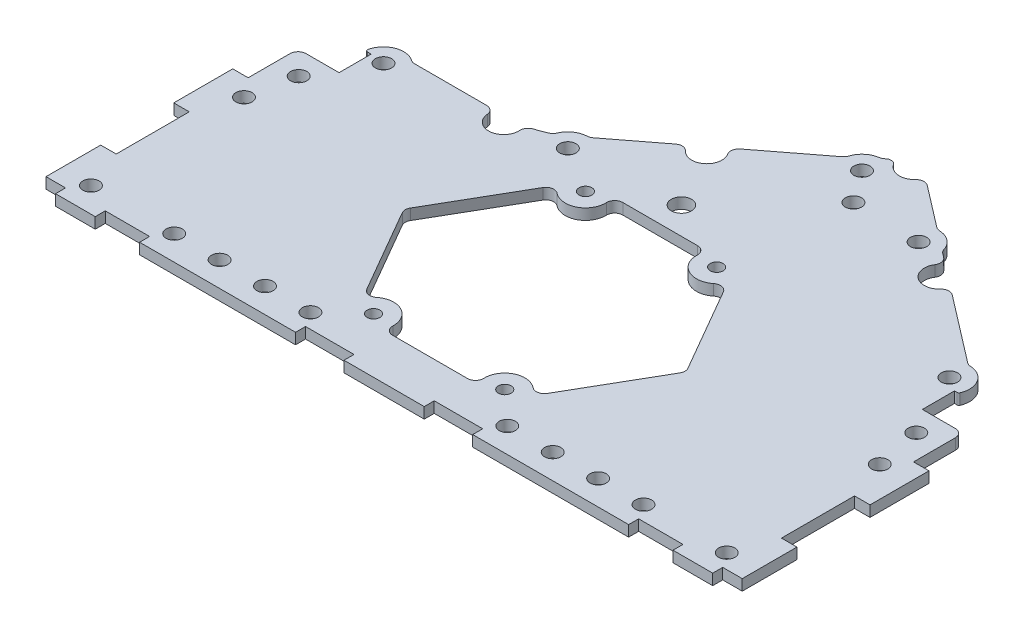
from build123d import *

# Parameters (mm, degrees)
SKETCH44_R              = 2.5527
TOP_PLATE_EXTRUDE_DEPTH = 3.429
SKETCH82_R              = 4.7625
CUT_EXTRUDE38_DEPTH     = 3.429
SKETCH72_W              = 4.7498
SKETCH72_H              = 17.4625
SKETCH72_W_2            = 49.2125
SKETCH72_H_2            = 3.0226
SKETCH72_H_3            = 18.806813894
SKETCH72_W_3            = 12.7
SKETCH72_H_4            = 9.525
BOSS_EXTRUDE27_DEPTH    = 3.429
SKETCH86_R              = 6.35
SKETCH86_R_2            = 2.5527
BOSS_EXTRUDE31_DEPTH    = 3.429
SKETCH111_W             = 17.7673
SKETCH111_H             = 10.0965
CUT_EXTRUDE57_DEPTH     = 191.27116943
SKETCH92_W              = 4.859785226
SKETCH92_H              = 15.6845
SKETCH92_W_2            = 4.8768
SKETCH92_H_2            = 22.987
SKETCH92_W_3            = 6.1468
SKETCH92_H_3            = 3.1496
SKETCH92_W_4            = 13.95095
SKETCH92_W_5            = 15.24635
CUT_EXTRUDE44_DEPTH     = 191.27116943
SKETCH95_R              = 2.0193
CUT_EXTRUDE47_DEPTH     = 25.4
SKETCH99_R              = 3.175
CUT_EXTRUDE50_DEPTH     = 191.27116943
FILLET5_R               = 2.54
FILLET6_R               = 2.54
FILLET7_R               = 2.54
FILLET8_R               = 1.905
FILLET42_R              = 0.635


with BuildPart() as part:
    # Sketch44 → Top Plate Extrude----------- (new body)
    with BuildSketch(Plane(origin=(0, 25.4, 0), x_dir=(1, 0, 0), z_dir=(0, 1, 0))):
        with BuildLine():
            Line((-104.775, -68.124686106), (-104.775, -152.527))
            Line((-104.775, -152.527), (104.775, -152.527))
            Line((104.775, -152.527), (104.775, -68.124686106))
            Line((104.775, -68.124686106), (92.075, -68.124686106))
            Line((92.075, -68.124686106), (92.075, -62.647632589))
            Line((92.075, -62.647632589), (21.81178084, -8.732768266))
            ThreePointArc((21.81178084, -8.732768266), (18.724426226, -14.191930366), (14.302849775, -18.63983673))
            Line((14.302849775, -18.63983673), (-38.049902469, -58.811516421))
            ThreePointArc((-38.049902469, -58.811516421), (-44.800532006, -62.419803084), (-52.352752243, -63.666679691))
            Line((-52.352752243, -63.666679691), (-92.075, -63.666679691))
            Line((-92.075, -63.666679691), (-92.075, -68.124686106))
            Line((-92.075, -68.124686106), (-104.775, -68.124686106))
        make_face()
        with Locations(Location((-73.83145, -147.7645, 0), (0, 0, 90))):
            Circle(SKETCH44_R, mode=Mode.SUBTRACT)
        with Locations(Location((-59.54395, -147.7645, 0), (0, 0, 90))):
            Circle(SKETCH44_R, mode=Mode.SUBTRACT)
        with Locations(Location((-45.25645, -147.7645, 0), (0, 0, 90))):
            Circle(SKETCH44_R, mode=Mode.SUBTRACT)
        with Locations(Location((-30.96895, -147.7645, 0), (0, 0, 90))):
            Circle(SKETCH44_R, mode=Mode.SUBTRACT)
        with Locations(Location((-100.0125, -99.6315, 0), (0, 0, 270))):
            Circle(SKETCH44_R, mode=Mode.SUBTRACT)
        with Locations(Location((-100.0125, -147.7645, 0), (0, 0, 270))):
            Circle(SKETCH44_R, mode=Mode.SUBTRACT)
        with Locations(Location((100.0125, -147.7645, 0), (0, 0, 90))):
            Circle(SKETCH44_R, mode=Mode.SUBTRACT)
        with Locations(Location((100.0125, -99.6315, 0), (0, 0, 90))):
            Circle(SKETCH44_R, mode=Mode.SUBTRACT)
        with Locations(Location((30.96895, -147.7645, 0), (0, 0, 270))):
            Circle(SKETCH44_R, mode=Mode.SUBTRACT)
        with Locations(Location((45.25645, -147.7645, 0), (0, 0, 270))):
            Circle(SKETCH44_R, mode=Mode.SUBTRACT)
        with Locations(Location((59.54395, -147.7645, 0), (0, 0, 270))):
            Circle(SKETCH44_R, mode=Mode.SUBTRACT)
        with Locations(Location((73.83145, -147.7645, 0), (0, 0, 270))):
            Circle(SKETCH44_R, mode=Mode.SUBTRACT)
        with Locations(Location((-87.3125, -68.429179691, 0), (0, 0, 270))):
            Circle(SKETCH44_R, mode=Mode.SUBTRACT)
        with Locations(Location((-35.150676163, -62.589861704, 0), (0, 0, 270))):
            Circle(SKETCH44_R, mode=Mode.SUBTRACT)
        with Locations(Location((17.20207608, -22.418182013, 0), (0, 0, 270))):
            Circle(SKETCH44_R, mode=Mode.SUBTRACT)
        with Locations(Location((45.531325629, -32.936414996, 0), (0, 0, 270))):
            Circle(SKETCH44_R, mode=Mode.SUBTRACT)
        with Locations(Location((87.3125, -64.996237681, 0), (0, 0, 270))):
            Circle(SKETCH44_R, mode=Mode.SUBTRACT)
        with Locations(Location((-97.155, -85.269686106, 0), (0, 0, 270))):
            Circle(SKETCH44_R, mode=Mode.SUBTRACT)
        with Locations(Location((24.512056641, -32.4155623, 0), (0, 0, 270))):
            Circle(SKETCH44_R, mode=Mode.SUBTRACT)
        with Locations(Location((97.155, -85.269686106, 0), (0, 0, 270))):
            Circle(SKETCH44_R, mode=Mode.SUBTRACT)
    extrude(amount=TOP_PLATE_EXTRUDE_DEPTH)

    # Sketch82 → Cut-Extrude38 (cut)
    with BuildSketch(Plane(origin=(0, 28.829, 0), x_dir=(1, 0, 0), z_dir=(0, 1, 0))):
        with Locations((-52.352752243, -65.571679691)):
            Circle(SKETCH82_R)
        with Locations((-12.44667807, -41.56667131)):
            Circle(SKETCH82_R)
        with Locations((58.296246284, -39.129483192)):
            Circle(SKETCH82_R)
        with BuildLine():
            Line((21.464274093, -9.555101394), (21.81178084, -8.732768266))
            Line((21.81178084, -8.732768266), (22.214272521, -9.041610995))
            ThreePointArc((22.214272521, -9.041610995), (27.20799018, -17.139845005), (21.464274093, -9.555101394))
        make_face()
    extrude(amount=-CUT_EXTRUDE38_DEPTH, mode=Mode.SUBTRACT)

    # Sketch72 → Boss-Extrude27 (add, through all)
    with BuildSketch(Plane(origin=(0, 25.4, 0), x_dir=(1, 0, 0), z_dir=(0, 1, 0))):
        with Locations((-107.1499, -143.79575)):
            Rectangle(SKETCH72_W, SKETCH72_H)
        with Locations((-52.4002, -154.0383)):
            Rectangle(SKETCH72_W_2, SKETCH72_H_2)
        with Locations((-107.1499, -102.928093053)):
            Rectangle(SKETCH72_W, SKETCH72_H_3)
        with Locations((-6.35, -154.0383)):
            Rectangle(SKETCH72_W_3, SKETCH72_H_2)
        with Locations((-107.1499, -72.887186106)):
            Rectangle(SKETCH72_W, SKETCH72_H_4)
        with Locations((-97.155, -154.0383)):
            Rectangle(SKETCH72_W_3, SKETCH72_H_2)
    boss_extrude27 = extrude(amount=BOSS_EXTRUDE27_DEPTH)

    # Mirror22: Boss-Extrude27 across plane
    add(boss_extrude27.mirror(Plane(origin=(0, 0, 0), x_dir=(0, 0, 1), z_dir=(1, 0, 0))))

    # Sketch86 → Boss-Extrude31 (add, through all)
    # profile 1 of 5: a face of its own
    with BuildSketch(Plane(origin=(0, 28.829, 0), x_dir=(1, 0, 0), z_dir=(0, 1, 0))):
        with Locations((87.3125, -64.996237681)):
            Circle(SKETCH86_R)
        with Locations(Location((87.3125, -64.996237681, 0), (0, 0, 270))):
            Circle(SKETCH86_R_2, mode=Mode.SUBTRACT)
    # profile 2 of 5: a face of its own
    with BuildSketch(Plane(origin=(0, 28.829, 0), x_dir=(1, 0, 0), z_dir=(0, 1, 0))):
        with Locations((17.20207608, -22.418182013)):
            Circle(SKETCH86_R)
        with Locations(Location((17.20207608, -22.418182013, 0), (0, 0, 270))):
            Circle(SKETCH86_R_2, mode=Mode.SUBTRACT)
    # profile 3 of 5: a face of its own
    with BuildSketch(Plane(origin=(0, 28.829, 0), x_dir=(1, 0, 0), z_dir=(0, 1, 0))):
        with Locations((45.531325629, -32.936414996)):
            Circle(SKETCH86_R)
        with Locations(Location((45.531325629, -32.936414996, 0), (0, 0, 270))):
            Circle(SKETCH86_R_2, mode=Mode.SUBTRACT)
    # profile 4 of 5: a face of its own
    with BuildSketch(Plane(origin=(0, 28.829, 0), x_dir=(1, 0, 0), z_dir=(0, 1, 0))):
        with Locations((-35.150676163, -62.589861704)):
            Circle(SKETCH86_R)
        with Locations(Location((-35.150676163, -62.589861704, 0), (0, 0, 270))):
            Circle(SKETCH86_R_2, mode=Mode.SUBTRACT)
    # profile 5 of 5: a face of its own
    with BuildSketch(Plane(origin=(0, 28.829, 0), x_dir=(1, 0, 0), z_dir=(0, 1, 0))):
        with Locations((-87.3125, -68.429179691)):
            Circle(SKETCH86_R)
        with Locations(Location((-87.3125, -68.429179691, 0), (0, 0, 270))):
            Circle(SKETCH86_R_2, mode=Mode.SUBTRACT)
    extrude(amount=-BOSS_EXTRUDE31_DEPTH)

    # Sketch111 → Cut-Extrude57 (cut, through all)
    with BuildSketch(Plane(origin=(0, 28.829, 0), x_dir=(1, 0, 0), z_dir=(0, 1, 0))):
        with Locations((-100.64115, -72.918936106)):
            Rectangle(SKETCH111_W, SKETCH111_H)
        with Locations((100.64115, -72.918936106)):
            Rectangle(SKETCH111_W, SKETCH111_H)
    extrude(amount=-CUT_EXTRUDE57_DEPTH, mode=Mode.SUBTRACT)

    # Sketch92 → Cut-Extrude44 (cut, through all)
    with BuildSketch(Plane(origin=(0, 28.829, 0), x_dir=(1, 0, 0), z_dir=(0, 1, 0))):
        with Locations((-107.094907387, -85.809436106)):
            Rectangle(SKETCH92_W, SKETCH92_H)
        with Locations((-107.0864, -123.698)):
            Rectangle(SKETCH92_W_2, SKETCH92_H_2)
        with Locations((-106.4514, -153.9748)):
            Rectangle(SKETCH92_W_3, SKETCH92_H_3)
        with Locations((-83.905725, -153.9748)):
            Rectangle(SKETCH92_W_4, SKETCH92_H_3)
        with Locations((-20.246975, -153.9748)):
            Rectangle(SKETCH92_W_5, SKETCH92_H_3)
    cut_extrude44 = extrude(amount=-CUT_EXTRUDE44_DEPTH, mode=Mode.SUBTRACT)

    # Mirror26: Cut-Extrude44 across plane
    add(cut_extrude44.mirror(Plane(origin=(0, 0, 0), x_dir=(0, 0, 1), z_dir=(1, 0, 0))), mode=Mode.SUBTRACT)

    # Sketch95 → Cut-Extrude47 (cut)
    with BuildSketch(Plane(origin=(0, 28.829, 0), x_dir=(1, 0, 0), z_dir=(0, 1, 0))):
        with BuildLine():
            Line((-14.966768676, -141.097), (14.966768676, -141.097))
            ThreePointArc((14.966768676, -141.097), (18.013644543, -132.45695017), (26.522246674, -135.853654954))
            Line((26.522246674, -135.853654954), (44.392192993, -104.902))
            Line((44.392192993, -104.902), (26.522246674, -73.950345046))
            ThreePointArc((26.522246674, -73.950345046), (18.013644543, -77.34704983), (14.966768676, -68.707))
            Line((14.966768676, -68.707), (-14.966768676, -68.707))
            ThreePointArc((-14.966768676, -68.707), (-18.013644543, -77.34704983), (-26.522246674, -73.950345046))
            Line((-26.522246674, -73.950345046), (-44.392192993, -104.902))
            Line((-44.392192993, -104.902), (-26.522246674, -135.853654954))
            ThreePointArc((-26.522246674, -135.853654954), (-18.013644543, -132.45695017), (-14.966768676, -141.097))
        make_face()
        with Locations(Location((-20.6375, -71.5645, 0), (0, 0, 270))):
            Circle(SKETCH95_R)
        with Locations(Location((20.6375, -71.5645, 0), (0, 0, 270))):
            Circle(SKETCH95_R)
        with Locations(Location((20.6375, -138.2395, 0), (0, 0, 270))):
            Circle(SKETCH95_R)
        with Locations(Location((-20.6375, -138.2395, 0), (0, 0, 270))):
            Circle(SKETCH95_R)
    extrude(amount=-CUT_EXTRUDE47_DEPTH, mode=Mode.SUBTRACT)

    # Sketch99 → Cut-Extrude50 (cut, through all)
    with BuildSketch(Plane(origin=(0, 28.829, 0), x_dir=(1, 0, 0), z_dir=(0, 1, 0))):
        with Locations(Location((-1.83388, -60.19546, 0), (0, 0, 270))):
            Circle(SKETCH99_R)
    extrude(amount=-CUT_EXTRUDE50_DEPTH, mode=Mode.SUBTRACT)

    # Fillet5
    fillet5_edges = [part.edges().sort_by_distance(p)[0] for p in [
        (26.522246674, 27.1145, 135.853654954),
        (14.966768676, 27.1145, 141.097),
        (-14.966768676, 27.1145, 141.097),
        (-26.522246674, 27.1145, 135.853654954),
        (-44.392192993, 27.1145, 104.902),
        (-26.522246674, 27.1145, 73.950345046),
        (-14.966768676, 27.1145, 68.707),
        (14.966768676, 27.1145, 68.707),
        (26.522246674, 27.1145, 73.950345046),
        (44.392192993, 27.1145, 104.902),
    ]]
    fillet(fillet5_edges, radius=FILLET5_R)

    # Fillet6
    # the kernel refuses this fillet: 2.54 mm, written as the material it takes off along each edge
    with BuildSketch(Plane(origin=(-92.075, 23.994075516, 63.666679691), x_dir=(1, 0, 0), z_dir=(0, 1, 0))) as fillet6_piece_1:
        with BuildLine():
            CenterArc((2.055088799, -2.055088799), FILLET6_R, 125.992875358, 18.014249284)
            Line((0, -0.562369794), (0, 0))
            Line((0, 0), (0.562369794, 0))
        make_face()
    extrude(amount=6.240848968, mode=Mode.SUBTRACT)

    # Fillet7
    fillet7_edges = [part.edges().sort_by_distance(p)[0] for p in [
        (-56.717655593, 27.1145, 63.666679691),
        (-17.069279245, 27.1145, 42.712517997),
        (-10.14345794, 27.1145, 37.398148396),
        (55.993026154, 27.1145, 34.960960278),
        (62.918847459, 27.1145, 40.275329879),
        (-48.171509306, 27.1145, 63.291632816),
        (29.140093826, 27.1145, 14.355980596),
        (86.879538977, 27.1145, 58.661015131),
        (17.141153982, 27.1145, 16.068474264),
        (10.970662446, 27.1145, 21.196713997),
        (51.762739264, 27.1145, 31.71494698),
        (45.098364606, 27.1145, 26.601192447),
        (-41.268255068, 27.1145, 60.88759018),
        (-34.71771514, 27.1145, 56.254639155),
        (-83.112369794, 27.1145, 63.666679691),
        (-104.665014774, 27.1145, 77.967186106),
        (104.665014774, 27.1145, 77.967186106),
    ]]
    fillet(fillet7_edges, radius=FILLET7_R)

    # Fillet8
    fillet8_edges = [part.edges().sort_by_distance(p)[0] for p in [
        (19.785658887, 27.1145, 12.670545663),
    ]]
    fillet(fillet8_edges, radius=FILLET8_R)

    # Fillet42
    fillet42_edges = [part.edges().sort_by_distance(p)[0] for p in [
        (-93.637892076, 27.1145, 67.870686106),
        (92.974659151, 27.1145, 67.870686106),
    ]]
    fillet(fillet42_edges, radius=FILLET42_R)


solid = part.part
